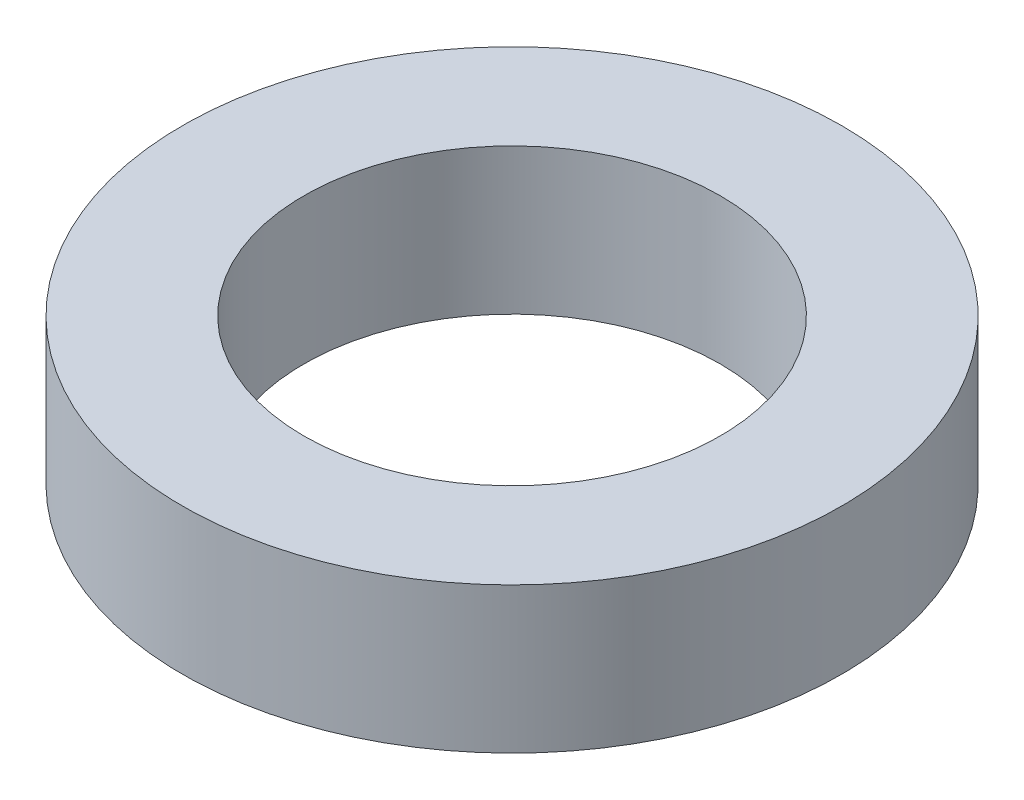
from build123d import *

# Parameters (mm, degrees)
SKETCH1_R           = 47.5
BOSS_EXTRUDE1_DEPTH = 21
SKETCH2_R           = 30
CUT_EXTRUDE1_DEPTH  = 71.381105419


with BuildPart() as part:
    # Sketch1 → Boss-Extrude1 (new body)
    with BuildSketch(Plane(origin=(0, 0, 0), x_dir=(1, 0, 0), z_dir=(0, 1, 0))):
        Circle(SKETCH1_R)
    extrude(amount=BOSS_EXTRUDE1_DEPTH)

    # Sketch2 → Cut-Extrude1 (cut, through all)
    with BuildSketch(Plane(origin=(0, 0, 0), x_dir=(1, 0, 0), z_dir=(0, 1, 0))):
        Circle(SKETCH2_R)
    extrude(amount=CUT_EXTRUDE1_DEPTH, mode=Mode.SUBTRACT)


solid = part.part
